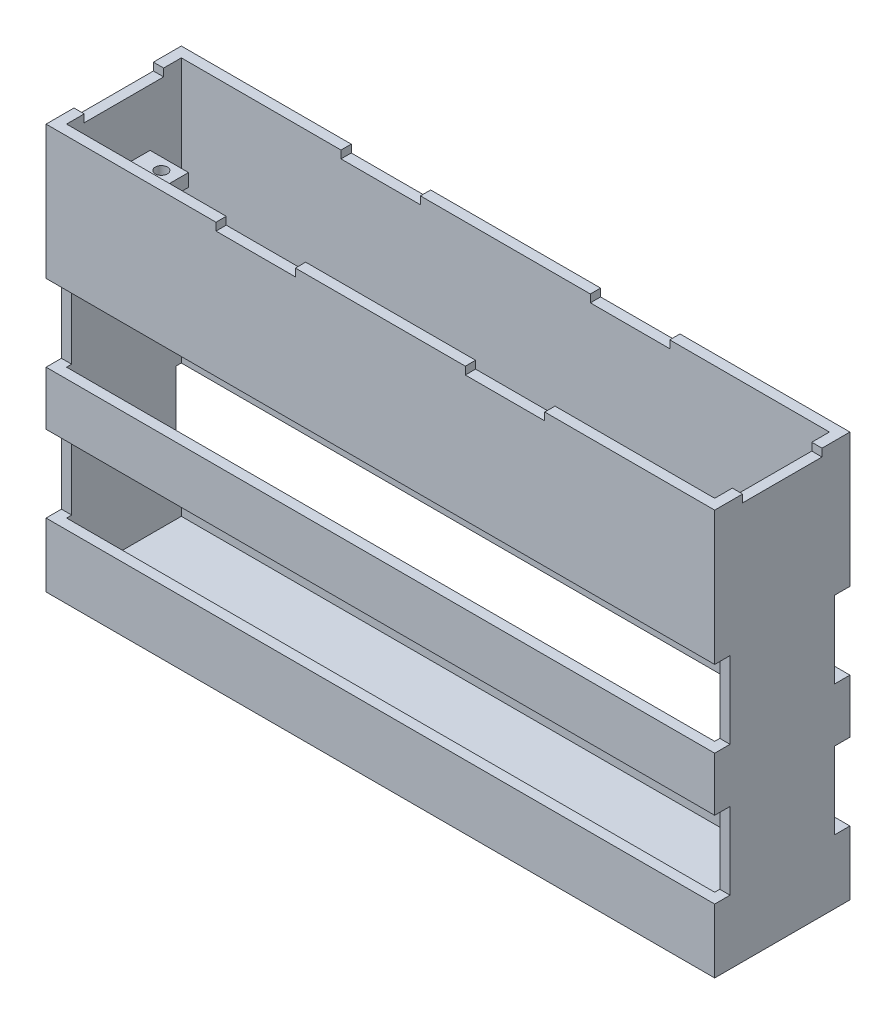
from build123d import *

# Parameters (mm, degrees)
SKETCH1_W                        = 261
SKETCH1_H                        = 52.8
BOSS_EXTRUDE1_DEPTH              = 3.175
SKETCH2_W                        = 261
SKETCH2_H                        = 52.8
SKETCH2_W_2                      = 253
SKETCH2_H_2                      = 44.8
BOSS_EXTRUDE2_DEPTH              = 155
SKETCH3_W                        = 6
SKETCH3_H                        = 30
CUT_EXTRUDE1_DEPTH               = 307.328729676
SKETCH4_W                        = 9.2
SKETCH4_H                        = 20
BOSS_EXTRUDE3_DEPTH              = 15
CHAMFER2_SIZE                    = 15
F_13_0_185_DIAMETER_HOLE1_REACH  = 190.192
F_13_0_185_DIAMETER_HOLE1_BORE_R = 2.3495
LPATTERN1_COUNT                  = 2
LPATTERN1_PITCH                  = 22.4
SKETCH7_W                        = 4
SKETCH7_H                        = 15.5
SKETCH7_W_2                      = 31
SKETCH7_H_2                      = 4
CUT_EXTRUDE2_DEPTH               = 3


# Read off the part's stored shape, not the designer's step: Mirror2
with BuildPart() as part:
    # Sketch1 → Boss-Extrude1 (new body)
    with BuildSketch(Plane(origin=(0, 0, 0), x_dir=(1, 0, 0), z_dir=(0, 1, 0))):
        Rectangle(SKETCH1_W, SKETCH1_H)
    extrude(amount=BOSS_EXTRUDE1_DEPTH)

    # Sketch2 → Boss-Extrude2 (add)
    with BuildSketch(Plane(origin=(0, 3.175, 0), x_dir=(1, 0, 0), z_dir=(0, 1, 0))):
        Rectangle(SKETCH2_W, SKETCH2_H)
        Rectangle(SKETCH2_W_2, SKETCH2_H_2, mode=Mode.SUBTRACT)
    extrude(amount=BOSS_EXTRUDE2_DEPTH)

    # Sketch3 → Cut-Extrude1 (cut, through all)
    with BuildSketch(Plane(origin=(130.5, 0, 0), x_dir=(0, 0, -1), z_dir=(1, 0, 0))):
        with Locations((-23.4, 91)):
            Rectangle(SKETCH3_W, SKETCH3_H)
        with Locations((-23.4, 40)):
            Rectangle(SKETCH3_W, SKETCH3_H)
    cut_extrude1 = extrude(amount=-CUT_EXTRUDE1_DEPTH, mode=Mode.SUBTRACT)

    # Mirror1: Cut-Extrude1 across plane
    add(cut_extrude1.mirror(Plane.XY), mode=Mode.SUBTRACT)

    # Sketch4 → Boss-Extrude3 (add)
    with BuildSketch(Plane.ZY.offset(-126.5)):
        with Locations((-5.6, 123)):
            Rectangle(SKETCH4_W, SKETCH4_H)
        with Locations((16.8, 123)):
            Rectangle(SKETCH4_W, SKETCH4_H)
    extrude(amount=BOSS_EXTRUDE3_DEPTH)

    # Chamfer2
    chamfer2_edges = [part.edges().sort_by_distance(p)[0] for p in [
        (111.5, 113, 16.8),
        (111.5, 113, -5.6),
    ]]
    chamfer(chamfer2_edges, length=CHAMFER2_SIZE - 0.0001)  # a hair under: the kernel refuses the full size

    # #13 (0.185) Diameter Hole1 bore → #13 (0.185) Diameter Hole1 (cut, up to next)
    with BuildSketch(Plane(origin=(0, 133, 0), x_dir=(1, 0, 0), z_dir=(0, 1, 0)), mode=Mode.PRIVATE) as f_13_0_185_diameter_hole1_sk1:
        with Locations((117.5, -16.8)):
            Circle(F_13_0_185_DIAMETER_HOLE1_BORE_R)
    f_13_0_185_diameter_hole1_tool1 = extrude(f_13_0_185_diameter_hole1_sk1.sketch, amount=-F_13_0_185_DIAMETER_HOLE1_REACH, mode=Mode.PRIVATE) & part.part
    f_13_0_185_diameter_hole1 = f_13_0_185_diameter_hole1_tool1.solids().sort_by_distance((117.5, 133, 16.8))[0]
    add(f_13_0_185_diameter_hole1, mode=Mode.SUBTRACT)

    # LPattern1: #13 (0.185) Diameter Hole1 ×2
    with Locations(*[(0, 0, -i * LPATTERN1_PITCH) for i in range(1, LPATTERN1_COUNT)]):
        add(f_13_0_185_diameter_hole1, mode=Mode.SUBTRACT)

    # Mirror2: part across plane


with BuildPart() as part_1:
    add(part.part)
    add(part.part.mirror(Plane(origin=(0, 0, 0), x_dir=(0, 0, 1), z_dir=(1, 0, 0))))

    # Sketch7 → Cut-Extrude2 (cut)
    with BuildSketch(Plane(origin=(0, 158.175, 0), x_dir=(1, 0, 0), z_dir=(0, 1, 0))):
        with Locations((128.5, 7.75)):
            Rectangle(SKETCH7_W, SKETCH7_H)
        with Locations((48.666666667, 24.4)):
            Rectangle(SKETCH7_W_2, SKETCH7_H_2)
        with Locations((-128.5, 7.75)):
            Rectangle(SKETCH7_W, SKETCH7_H)
        with Locations((-48.666666667, 24.4)):
            Rectangle(SKETCH7_W_2, SKETCH7_H_2)
    cut_extrude2 = extrude(amount=-CUT_EXTRUDE2_DEPTH, mode=Mode.SUBTRACT)

    # Mirror3: Cut-Extrude2 across plane
    add(cut_extrude2.mirror(Plane.XY), mode=Mode.SUBTRACT)


solid = part_1.part
